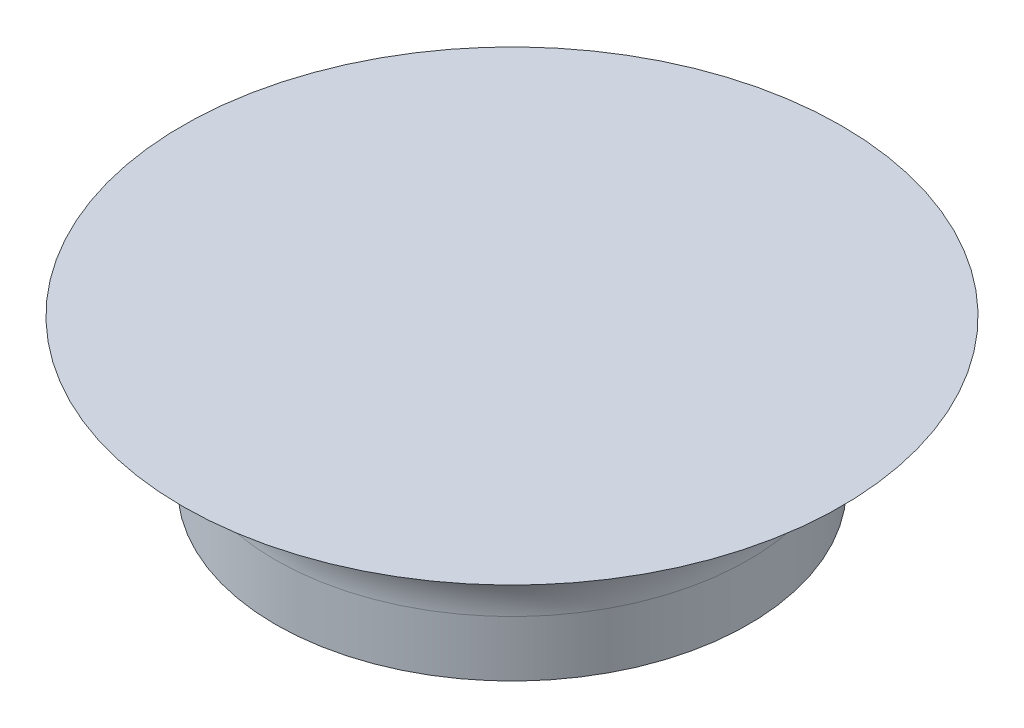
from build123d import *

# Parameters (mm, degrees)
SKETCH1_W          = 50
SKETCH1_H          = 5
BASE_EXTRUDE_DEPTH = 25
SKETCH5_W          = 6.35
SKETCH5_H          = 4
FILLET3_R          = 2.5
SKETCH6_W          = 50
SKETCH6_H          = 5
CUT_EXTRUDE2_DEPTH = 57.124860802


with BuildPart() as part:
    # Sketch1 → Base-Extrude (new, symmetric)
    with BuildSketch(Plane.XY):
        with Locations((0, 2.5)):
            Rectangle(SKETCH1_W, SKETCH1_H)
    extrude(amount=BASE_EXTRUDE_DEPTH, both=True)

    # Sketch5 → Boss-Revolve1 (revolve)
    with BuildSketch(Plane.XY):
        with Locations((3.175, -2)):
            Rectangle(SKETCH5_W, SKETCH5_H)
    revolve(axis=Axis((0, 0, 0), (0, -1, 0)))

    # Fillet3
    fillet3_edges = [part.edges().sort_by_distance(p)[0] for p in [
        (-6.35, 0, 0),
    ]]
    fillet(fillet3_edges, radius=FILLET3_R)

    # Sketch6 → Cut-Extrude2 (cut, through all)
    with BuildSketch(Plane(origin=(25, 0, 0), x_dir=(0, 0, -1), z_dir=(1, 0, 0))):
        with Locations((0, 2.5)):
            Rectangle(SKETCH6_W, SKETCH6_H)
    extrude(amount=-CUT_EXTRUDE2_DEPTH, mode=Mode.SUBTRACT)


solid = part.part
